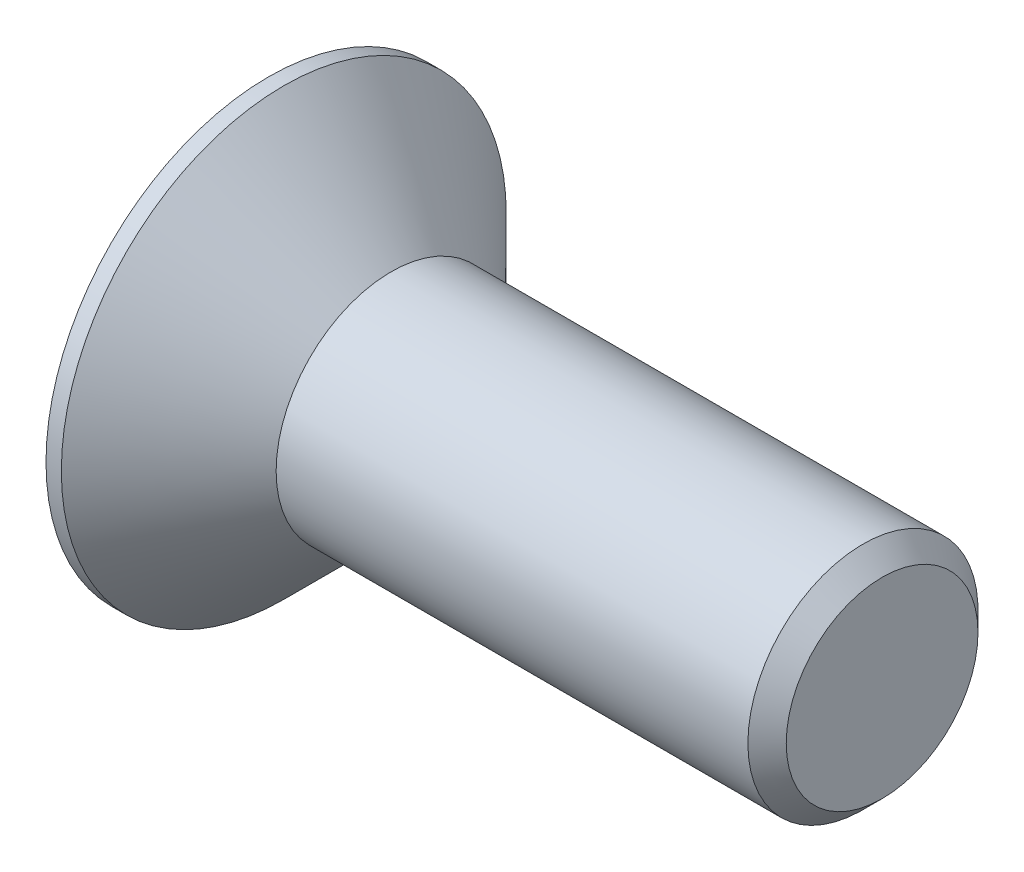
from build123d import *

# Parameters (mm, degrees)
CUT_EXTRUDE1_DEPTH = 0.8


with BuildPart() as part:
    # Sketch2 → Revolve1 (revolve)
    with BuildSketch(Plane.XY):
        Polygon((0, 0), (0, 2.9), (0.2, 2.9), (1.6, 1.5), (7.75, 1.5), (8, 1.25), (8, 0), align=None)
    revolve(axis=Axis((-2.281841559, 0, 0), (1, 0, 0)))

    # Sketch3 → Cut-Extrude1 (cut)
    with BuildSketch(Plane.ZY):
        Polygon((0.721687836, -1.25), (1.443375673, 0), (0.721687836, 1.25), (-0.721687836, 1.25), (-1.443375673, 0), (-0.721687836, -1.25), align=None)
    extrude(amount=-CUT_EXTRUDE1_DEPTH, mode=Mode.SUBTRACT)


solid = part.part
